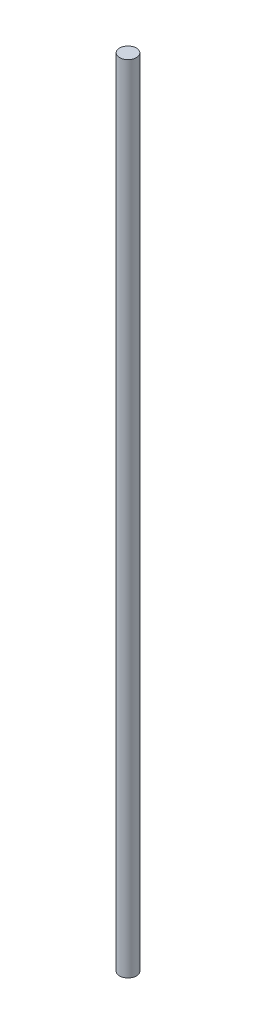
from build123d import *

# Parameters (mm, degrees)
SKETCH1_R           = 6.35
BOSS_EXTRUDE1_DEPTH = 301.625


with BuildPart() as part:
    # Sketch1 → Boss-Extrude1 (new, symmetric)
    with BuildSketch(Plane(origin=(0, 0, 0), x_dir=(1, 0, 0), z_dir=(0, 1, 0))):
        Circle(SKETCH1_R)
    extrude(amount=BOSS_EXTRUDE1_DEPTH, both=True)


solid = part.part
